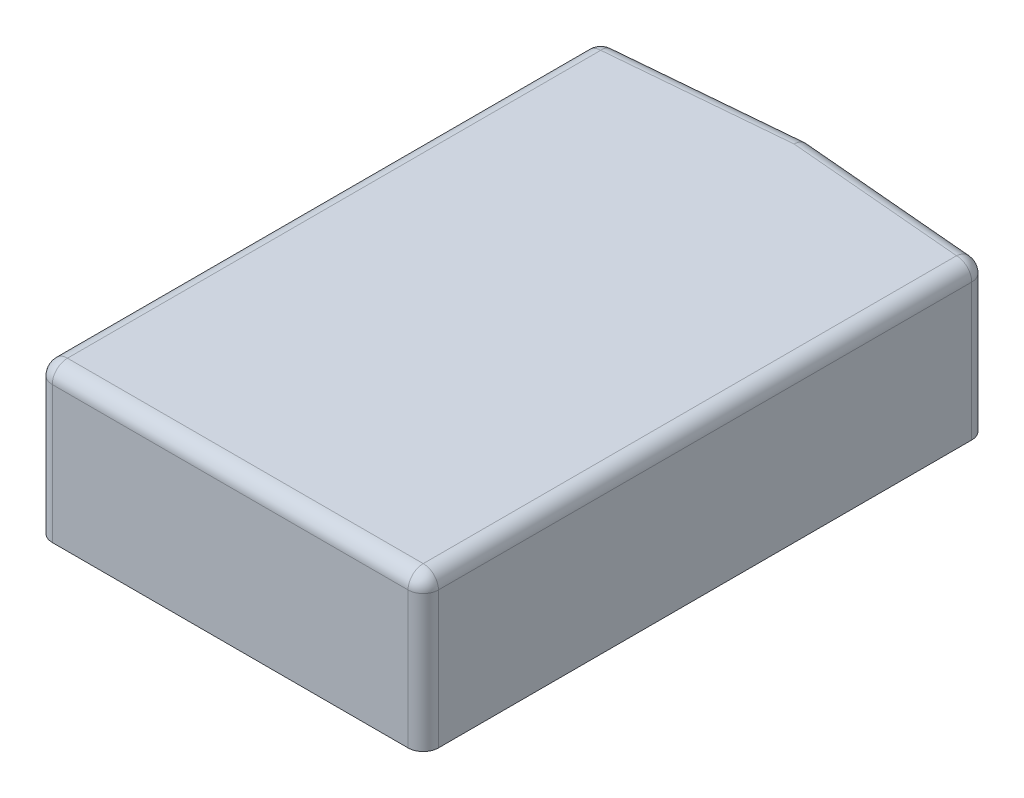
from build123d import *

# Parameters (mm, degrees)
SKETCH1_W           = 50.8
SKETCH1_H           = 76.2
BOSS_EXTRUDE2_DEPTH = 20
SKETCH2_R           = 3.7
BOSS_EXTRUDE3_DEPTH = 2
CHAMFER7_SIZE       = 2.222212054
CHAMFER7_SIZE_2     = 25.4
FILLET6_R           = 2
FILLET7_R           = 2
FILLET8_R           = 2
FILLET9_R           = 2
FILLET10_R          = 2


with BuildPart() as part:
    # Sketch1 → Boss-Extrude2 (new body)
    with BuildSketch(Plane(origin=(0, 0, 0), x_dir=(1, 0, 0), z_dir=(0, 1, 0))):
        Rectangle(SKETCH1_W, SKETCH1_H)
    extrude(amount=BOSS_EXTRUDE2_DEPTH)

    # Sketch2 → Boss-Extrude3 (add)
    with BuildSketch(Plane(origin=(0, 0, -38.1), x_dir=(-1, 0, 0), z_dir=(0, 0, -1))):
        with Locations((-15.4, 10)):
            Circle(SKETCH2_R)
        with Locations((15.4, 10)):
            Circle(SKETCH2_R)
    extrude(amount=BOSS_EXTRUDE3_DEPTH)

    # Chamfer7
    # the kernel refuses this chamfer: 25.4, 2.222212054 mm, written as the material it takes off along each edge
    with BuildSketch(Plane(origin=(-25.4, -66.030705628, -38.1), x_dir=(-0.40120984275090654, 0, 0.9159861691531116), z_dir=(0, 1, 0))) as chamfer7_piece_1_section:
        Polygon((CHAMFER7_SIZE * 0.915986168971, CHAMFER7_SIZE * 0.401209842671), (-CHAMFER7_SIZE_2 * 0.401209842751, CHAMFER7_SIZE_2 * 0.915986169153), (0, 0), align=None)
    chamfer7_piece_1 = extrude(amount=152.061411256, mode=Mode.PRIVATE)
    chamfer7_piece_1 = chamfer7_piece_1 - Plane(origin=(-15.4, 10, -36.375506271), x_dir=(-1, 0, 0), z_dir=(0, 0, 1)) * Cylinder(3.7, 398, mode=Mode.PRIVATE)
    add(chamfer7_piece_1, mode=Mode.SUBTRACT)
    with BuildSketch(Plane(origin=(25.4, -66.030705628, -38.1), x_dir=(0.4012098427509076, 0, 0.9159861691531113), z_dir=(0, 1, 0))) as chamfer7_piece_2_section:
        Polygon((CHAMFER7_SIZE * 0.915986168971, -CHAMFER7_SIZE * 0.401209842671), (-CHAMFER7_SIZE_2 * 0.401209842751, -CHAMFER7_SIZE_2 * 0.915986169153), (0, 0), align=None)
    chamfer7_piece_2 = extrude(amount=152.061411256, mode=Mode.PRIVATE)
    chamfer7_piece_2 = chamfer7_piece_2 - Plane(origin=(15.4, 10, -36.375506337), x_dir=(-1, 0, 0), z_dir=(0, 0, 1)) * Cylinder(3.7, 398, mode=Mode.PRIVATE)
    add(chamfer7_piece_2, mode=Mode.SUBTRACT)

    # Fillet6
    fillet6_edges = [part.edges().sort_by_distance(p)[0] for p in [
        (25.4, 20, 1.111106027),
        (0, 20, 38.1),
        (12.7, 20, -36.988893973),
        (-12.7, 20, -36.988893973),
        (-25.4, 20, 1.111106027),
    ]]
    fillet(fillet6_edges, radius=FILLET6_R)

    # Fillet7
    # the kernel refuses this fillet: 2 mm, written as the material it takes off along each edge
    with BuildSketch(Plane(origin=(23.4, 18, -34.045125598), x_dir=(1, 0, 0), z_dir=(0, 1, 0))) as fillet7_piece_1_section:
        Polygon((0, 0), (FILLET7_R, 0), (FILLET7_R, FILLET7_R * 0.916331174017), (FILLET7_R * 0.0871557427476, FILLET7_R * 0.996194698092), align=None)
    fillet7_piece_1 = extrude(amount=FILLET7_R, mode=Mode.PRIVATE)
    fillet7_piece_1 = fillet7_piece_1 - Plane(origin=(23.4, 18, -34.045125598), x_dir=(-0.73727733681012, 0, 0.6755902076156647), z_dir=(0, 1, 0)) * Sphere(FILLET7_R, mode=Mode.PRIVATE)
    add(fillet7_piece_1, mode=Mode.SUBTRACT)
    with BuildSketch(Plane(origin=(25.4, -4.58165587, -35.877787946), x_dir=(0, 0, 1), z_dir=(0, 1, 0))) as fillet7_piece_2:
        with BuildLine():
            CenterArc((FILLET7_R * 0.916331174017, -FILLET7_R), FILLET7_R, 90, 85)
            Line((-FILLET7_R * 0.0798635240743, -FILLET7_R * 0.912844257252), (0, 0))
            Line((0, 0), (FILLET7_R * 0.916331174017, 0))
        make_face()
    extrude(amount=22.58165587, mode=Mode.SUBTRACT)

    # Fillet8
    # the kernel refuses this fillet: 2 mm, written as the material it takes off along each edge
    with BuildSketch(Plane(origin=(23.4, 18, 36.1), x_dir=(1, 0, 0), z_dir=(0, 0, 1))) as fillet8_piece_1_section:
        Polygon((0, 0), (FILLET8_R, 0), (FILLET8_R, FILLET8_R), (0, FILLET8_R), align=None)
    fillet8_piece_1 = extrude(amount=FILLET8_R, mode=Mode.PRIVATE)
    fillet8_piece_1 = fillet8_piece_1 - Plane(origin=(23.4, 18, 36.1), x_dir=(-0.7071067811865475, -0.7071067811865475, 0), z_dir=(0, 0, 1)) * Sphere(FILLET8_R, mode=Mode.PRIVATE)
    add(fillet8_piece_1, mode=Mode.SUBTRACT)
    with BuildSketch(Plane(origin=(25.4, -5, 38.1), x_dir=(-1, 0, 0), z_dir=(0, 1, 0))) as fillet8_piece_2:
        with BuildLine():
            CenterArc((FILLET8_R, -FILLET8_R), FILLET8_R, 90, 90)
            Line((0, -FILLET8_R), (0, 0))
            Line((0, 0), (FILLET8_R, 0))
        make_face()
    extrude(amount=23, mode=Mode.SUBTRACT)

    # Fillet9
    # the kernel refuses this fillet: 2 mm, written as the material it takes off along each edge
    with BuildSketch(Plane(origin=(-23.4, 18, 36.1), x_dir=(-1, 0, 0), z_dir=(0, 0, 1))) as fillet9_piece_1_section:
        Polygon((0, 0), (FILLET9_R, 0), (FILLET9_R, -FILLET9_R), (0, -FILLET9_R), align=None)
    fillet9_piece_1 = extrude(amount=FILLET9_R, mode=Mode.PRIVATE)
    fillet9_piece_1 = fillet9_piece_1 - Plane(origin=(-23.4, 18, 36.1), x_dir=(0.7071067811865475, -0.7071067811865475, 0), z_dir=(0, 0, 1)) * Sphere(FILLET9_R, mode=Mode.PRIVATE)
    add(fillet9_piece_1, mode=Mode.SUBTRACT)
    with BuildSketch(Plane(origin=(-25.4, -5, 38.1), x_dir=(1, 0, 0), z_dir=(0, 1, 0))) as fillet9_piece_2:
        with BuildLine():
            CenterArc((FILLET9_R, FILLET9_R), FILLET9_R, 180, 90)
            Line((0, FILLET9_R), (0, 0))
            Line((0, 0), (FILLET9_R, 0))
        make_face()
    extrude(amount=23, mode=Mode.SUBTRACT)

    # Fillet10
    # the kernel refuses this fillet: 2 mm, written as the material it takes off along each edge
    with BuildSketch(Plane(origin=(-23.4, 18, -34.045125598), x_dir=(-1, 0, 0), z_dir=(0, 1, 0))) as fillet10_piece_1_section:
        Polygon((0, 0), (FILLET10_R, 0), (FILLET10_R, -FILLET10_R * 0.916331174017), (FILLET10_R * 0.0871557427476, -FILLET10_R * 0.996194698092), align=None)
    fillet10_piece_1 = extrude(amount=FILLET10_R, mode=Mode.PRIVATE)
    fillet10_piece_1 = fillet10_piece_1 - Plane(origin=(-23.4, 18, -34.045125598), x_dir=(0.73727733681012, 0, 0.6755902076156647), z_dir=(0, 1, 0)) * Sphere(FILLET10_R, mode=Mode.PRIVATE)
    add(fillet10_piece_1, mode=Mode.SUBTRACT)
    with BuildSketch(Plane(origin=(-25.4, -4.58165587, -35.877787946), x_dir=(0, 0, 1), z_dir=(0, 1, 0))) as fillet10_piece_2:
        with BuildLine():
            CenterArc((FILLET10_R * 0.916331174017, FILLET10_R), FILLET10_R, 185, 85)
            Line((-FILLET10_R * 0.0798635240743, FILLET10_R * 0.912844257252), (0, 0))
            Line((0, 0), (FILLET10_R * 0.916331174017, 0))
        make_face()
    extrude(amount=22.58165587, mode=Mode.SUBTRACT)


solid = part.part
